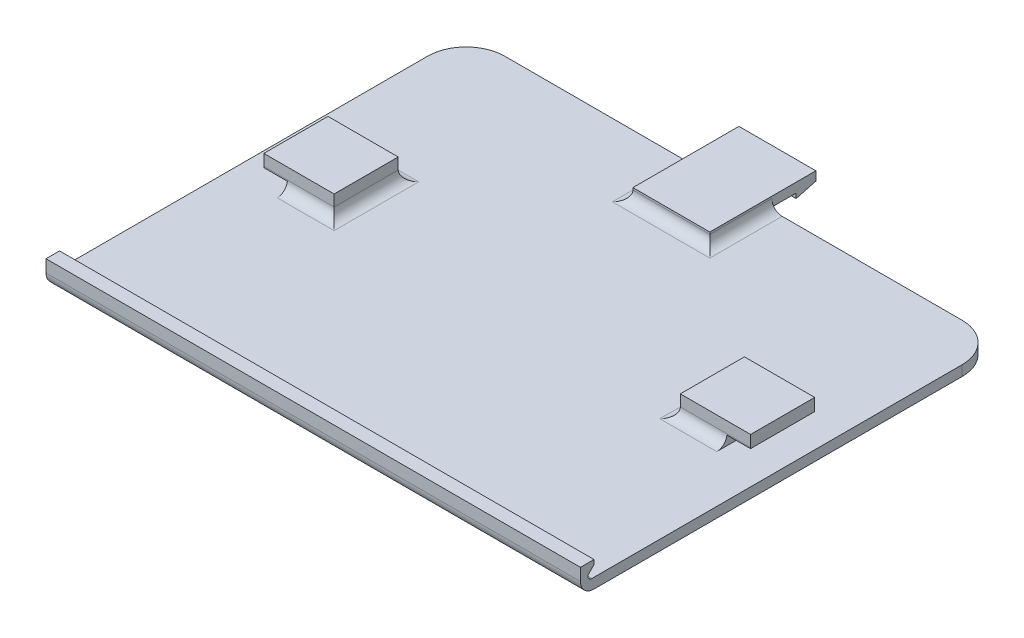
from build123d import *

# Parameters (mm, degrees)
SKETCH1_W            = 66.675
SKETCH1_H            = 52.2732
BOSS_EXTRUDE1_DEPTH  = 1.27
BOSS_EXTRUDE3_DEPTH  = 4.7625
BOSS_EXTRUDE4_DEPTH  = 7.9375
CUT_EXTRUDE2_DEPTH   = 2.921
FILLET1_R            = 1.27
FILLET2_R            = 1.27
MIRROR1_START        = 20.16125
MIRROR1_DEPTH        = 7.0485
MIRROR1_START_2      = 27.20975
MIRROR1_2_DEPTH      = 2.921
MIRROR1_START_3      = -8
MIRROR1_3_DEPTH      = 12
SKETCH7_W            = 1.016
SKETCH7_H            = 1.905
BOSS_EXTRUDE5_DEPTH  = 66.675
SKETCH8_W            = 66.675
SKETCH8_H            = 0.6604
BOSS_EXTRUDE6_DEPTH  = 0.762
FILLET5_R            = 1.651
SKETCH10_W           = 9.525
SKETCH10_H           = 2.7178
CUT_EXTRUDE3_DEPTH   = 0.1016
SKETCH11_W           = 66.675
SKETCH11_H           = 1.2446
CUT_EXTRUDE4_DEPTH   = 0.1016
SKETCH12_W           = 107.616027614
SKETCH12_H           = 63.046095141
SKETCH12_W_2         = 66.167
SKETCH12_H_2         = 53.768388695
CUT_EXTRUDE5_DEPTH   = 46.918560191
FILLET6_R            = 4.7625
SKETCH13_W           = 0.8636
SKETCH13_H           = 0.6604
CUT_EXTRUDE6_DEPTH   = 74.315736052
BOSS_EXTRUDE8_DEPTH  = 66.167
FILLET7_R            = 0.508
BOSS_EXTRUDE9_DEPTH  = 66.167
SKETCH17_W           = 9.525
SKETCH17_H           = 1.1684
BOSS_EXTRUDE10_DEPTH = 1.27
SKETCH18_W           = 12.7
SKETCH18_H           = 4.7625
BOSS_EXTRUDE13_DEPTH = 0.508
FILLET8_R            = 0.3048


with BuildPart() as part:
    # Sketch1 → Boss-Extrude1 (new body)
    with BuildSketch(Plane(origin=(0, 0, 0), x_dir=(1, 0, 0), z_dir=(0, 1, 0))):
        Rectangle(SKETCH1_W, SKETCH1_H)
    extrude(amount=BOSS_EXTRUDE1_DEPTH)

    # Sketch4 → Boss-Extrude3 (add, symmetric)
    with BuildSketch(Plane(origin=(0, 0, 0), x_dir=(0, 0, -1), z_dir=(1, 0, 0))):
        Polygon((28.987783874, 1.055971868), (31.3309, 1.683807942), (31.3309, 2.794), (18.1991, 2.794), (18.1991, 1.27), (26.1366, 1.27), (26.1366, 1.524), (28.8544, 1.524), (28.8544, 1.055971868), align=None)
    extrude(amount=BOSS_EXTRUDE3_DEPTH, both=True)

    # Sketch5 → Boss-Extrude4 (add)
    with BuildSketch(Plane(origin=(0, 0, -5.8166), x_dir=(-1, 0, 0), z_dir=(0, 0, -1))):
        Polygon((21.43125, 1.27), (27.20975, 1.27), (27.20975, 2.413), (30.13075, 2.413), (30.13075, 3.937), (21.43125, 3.937), align=None)
    extrude(amount=-BOSS_EXTRUDE4_DEPTH)

    # Sketch6 → Cut-Extrude2 (cut)
    with BuildSketch(Plane.ZY.offset(30.13075)):
        Polygon((-5.8166, 2.413), (-3.2766, 2.413), (-5.8166, 3.093590949), align=None)
    extrude(amount=-CUT_EXTRUDE2_DEPTH, mode=Mode.SUBTRACT)

    # Fillet1
    fillet1_edges = [part.edges().sort_by_distance(p)[0] for p in [
        (-24.3205, 1.27, 2.1209),
        (-21.43125, 1.27, -1.84785),
        (-24.3205, 1.27, -5.8166),
    ]]
    fillet(fillet1_edges, radius=FILLET1_R)

    # Fillet2
    # the kernel refuses this fillet: 1.27 mm, written as the material it adds along each edge
    with BuildSketch(Plane(origin=(-4.7625, 1.27, -18.1991), x_dir=(-1, 0, 0), z_dir=(0, 0, -1))) as fillet2_piece_1:
        with BuildLine():
            CenterArc((FILLET2_R, FILLET2_R), FILLET2_R, 180, 90)
            Line((0, FILLET2_R), (-FILLET2_R * 0.02, FILLET2_R))
            Line((-FILLET2_R * 0.02, FILLET2_R), (-FILLET2_R * 0.02, -FILLET2_R * 0.02))
            Line((-FILLET2_R * 0.02, -FILLET2_R * 0.02), (FILLET2_R, -FILLET2_R * 0.02))
            Line((FILLET2_R, -FILLET2_R * 0.02), (FILLET2_R, 0))
        make_face()
    extrude(amount=7.9375)
    with BuildSketch(Plane(origin=(-4.7625, 1.27, -18.1991), x_dir=(0, 0, 1), z_dir=(1, 0, 0))) as fillet2_piece_2:
        with BuildLine():
            CenterArc((FILLET2_R, -FILLET2_R), FILLET2_R, 90, 90)
            Line((0, -FILLET2_R), (-FILLET2_R * 0.02, -FILLET2_R))
            Line((-FILLET2_R * 0.02, -FILLET2_R), (-FILLET2_R * 0.02, FILLET2_R * 0.02))
            Line((-FILLET2_R * 0.02, FILLET2_R * 0.02), (FILLET2_R, FILLET2_R * 0.02))
            Line((FILLET2_R, FILLET2_R * 0.02), (FILLET2_R, 0))
        make_face()
    extrude(amount=9.525)
    with BuildSketch(Plane(origin=(4.7625, 1.27, -18.1991), x_dir=(1, 0, 0), z_dir=(0, 0, -1))) as fillet2_piece_3:
        with BuildLine():
            CenterArc((FILLET2_R, -FILLET2_R), FILLET2_R, 90, 90)
            Line((0, -FILLET2_R), (-FILLET2_R * 0.02, -FILLET2_R))
            Line((-FILLET2_R * 0.02, -FILLET2_R), (-FILLET2_R * 0.02, FILLET2_R * 0.02))
            Line((-FILLET2_R * 0.02, FILLET2_R * 0.02), (FILLET2_R, FILLET2_R * 0.02))
            Line((FILLET2_R, FILLET2_R * 0.02), (FILLET2_R, 0))
        make_face()
    extrude(amount=7.9375)
    with BuildSketch(Plane(origin=(-4.7625, 1.27, -15.0241), x_dir=(-1, 0, 0), z_dir=(0, 0, -1))) as fillet2_piece_4a_section:
        with BuildLine():
            CenterArc((FILLET2_R, FILLET2_R), FILLET2_R, 180, 90)
            Line((0, FILLET2_R), (-FILLET2_R * 0.02, FILLET2_R))
            Line((-FILLET2_R * 0.02, FILLET2_R), (-FILLET2_R * 0.02, -FILLET2_R * 0.02))
            Line((-FILLET2_R * 0.02, -FILLET2_R * 0.02), (FILLET2_R, -FILLET2_R * 0.02))
            Line((FILLET2_R, -FILLET2_R * 0.02), (FILLET2_R, 0))
        make_face()
    fillet2_piece_4a = extrude(amount=11.1125, mode=Mode.PRIVATE)
    fillet2_piece_4a = split(fillet2_piece_4a, bisect_by=Plane(origin=(-4.7625, 1.27, -18.1991), z_dir=(0, 0, 1)), keep=Keep.TOP, mode=Mode.PRIVATE)
    with BuildSketch(Plane(origin=(-7.9375, 1.27, -18.1991), x_dir=(0, 0, 1), z_dir=(1, 0, 0))) as fillet2_piece_4b_section:
        with BuildLine():
            CenterArc((FILLET2_R, -FILLET2_R), FILLET2_R, 90, 90)
            Line((0, -FILLET2_R), (-FILLET2_R * 0.02, -FILLET2_R))
            Line((-FILLET2_R * 0.02, -FILLET2_R), (-FILLET2_R * 0.02, FILLET2_R * 0.02))
            Line((-FILLET2_R * 0.02, FILLET2_R * 0.02), (FILLET2_R, FILLET2_R * 0.02))
            Line((FILLET2_R, FILLET2_R * 0.02), (FILLET2_R, 0))
        make_face()
    fillet2_piece_4b = extrude(amount=12.7, mode=Mode.PRIVATE)
    fillet2_piece_4b = split(fillet2_piece_4b, bisect_by=Plane(origin=(-4.7625, 1.27, -18.1991), z_dir=(-1, 0, 0)), keep=Keep.TOP, mode=Mode.PRIVATE)
    fillet2_piece_4 = fillet2_piece_4a & fillet2_piece_4b
    add(fillet2_piece_4)
    with BuildSketch(Plane(origin=(-4.7625, 1.27, -18.1991), x_dir=(0, 0, 1), z_dir=(1, 0, 0))) as fillet2_piece_5a_section:
        with BuildLine():
            CenterArc((FILLET2_R, -FILLET2_R), FILLET2_R, 90, 90)
            Line((0, -FILLET2_R), (-FILLET2_R * 0.02, -FILLET2_R))
            Line((-FILLET2_R * 0.02, -FILLET2_R), (-FILLET2_R * 0.02, FILLET2_R * 0.02))
            Line((-FILLET2_R * 0.02, FILLET2_R * 0.02), (FILLET2_R, FILLET2_R * 0.02))
            Line((FILLET2_R, FILLET2_R * 0.02), (FILLET2_R, 0))
        make_face()
    fillet2_piece_5a = extrude(amount=12.7, mode=Mode.PRIVATE)
    fillet2_piece_5a = split(fillet2_piece_5a, bisect_by=Plane(origin=(4.7625, 1.27, -18.1991), z_dir=(1, 0, 0)), keep=Keep.TOP, mode=Mode.PRIVATE)
    with BuildSketch(Plane(origin=(4.7625, 1.27, -15.0241), x_dir=(1, 0, 0), z_dir=(0, 0, -1))) as fillet2_piece_5b_section:
        with BuildLine():
            CenterArc((FILLET2_R, -FILLET2_R), FILLET2_R, 90, 90)
            Line((0, -FILLET2_R), (-FILLET2_R * 0.02, -FILLET2_R))
            Line((-FILLET2_R * 0.02, -FILLET2_R), (-FILLET2_R * 0.02, FILLET2_R * 0.02))
            Line((-FILLET2_R * 0.02, FILLET2_R * 0.02), (FILLET2_R, FILLET2_R * 0.02))
            Line((FILLET2_R, FILLET2_R * 0.02), (FILLET2_R, 0))
        make_face()
    fillet2_piece_5b = extrude(amount=11.1125, mode=Mode.PRIVATE)
    fillet2_piece_5b = split(fillet2_piece_5b, bisect_by=Plane(origin=(4.7625, 1.27, -18.1991), z_dir=(0, 0, 1)), keep=Keep.TOP, mode=Mode.PRIVATE)
    fillet2_piece_5 = fillet2_piece_5a & fillet2_piece_5b
    add(fillet2_piece_5)

    # Mirror1: read off the stored shape, not the designer's step
    # Mirror1 outline → Mirror1 (add)
    with BuildSketch(Plane.YZ.offset(MIRROR1_START)):
        with BuildLine():
            Line((3.937, -5.8166), (3.937, 2.1209))
            Line((3.937, 2.1209), (2.54, 2.1209))
            ThreePointArc((2.54, 2.1209), (1.641974388, 2.492874388), (1.27, 3.3909))
            Line((1.27, 3.3909), (1.27, -7.0866))
            ThreePointArc((1.27, -7.0866), (1.641974388, -6.188574388), (2.54, -5.8166))
            Line((2.54, -5.8166), (3.937, -5.8166))
        make_face()
    extrude(amount=MIRROR1_DEPTH)

    # Mirror1 2 outline → Mirror1 2 (add)
    with BuildSketch(Plane.YZ.offset(MIRROR1_START_2)):
        with BuildLine():
            Line((3.937, -5.8166), (3.937, 2.1209))
            Line((3.937, 2.1209), (2.54, 2.1209))
            ThreePointArc((2.54, 2.1209), (2.476420276, 2.122492487), (2.413, 2.127265955))
            Line((2.413, 2.127265955), (2.413, -5.822965955))
            ThreePointArc((2.413, -5.822965955), (2.476420276, -5.818192487), (2.54, -5.8166))
            Line((2.54, -5.8166), (3.937, -5.8166))
        make_face()
    extrude(amount=MIRROR1_2_DEPTH)

    # Mirror1 3 outline → Mirror1 3 (cut)
    with BuildSketch(Plane.XY.offset(MIRROR1_START_3)):
        with BuildLine():
            ThreePointArc((20.16125, 1.27), (21.059275612, 1.641974388), (21.43125, 2.54))
            Line((21.43125, 2.54), (21.43125, 3.937))
            Line((21.43125, 3.937), (20.16125, 3.937))
            Line((20.16125, 3.937), (20.16125, 1.27))
        make_face()
    extrude(amount=MIRROR1_3_DEPTH, mode=Mode.SUBTRACT)

    # Sketch7 → Boss-Extrude5 (add)
    with BuildSketch(Plane.ZY.offset(33.3375)):
        with Locations((25.6286, 2.2225)):
            Rectangle(SKETCH7_W, SKETCH7_H)
    extrude(amount=-BOSS_EXTRUDE5_DEPTH)

    # Sketch8 → Boss-Extrude6 (add)
    with BuildSketch(Plane(origin=(0, 0, 25.1206), x_dir=(-1, 0, 0), z_dir=(0, 0, -1))):
        with Locations((0, 2.8448)):
            Rectangle(SKETCH8_W, SKETCH8_H)
    extrude(amount=BOSS_EXTRUDE6_DEPTH)

    # Fillet5
    fillet5_edges = [part.edges().sort_by_distance(p)[0] for p in [
        (0, 0, 26.1366),
    ]]
    fillet(fillet5_edges, radius=FILLET5_R)

    # Sketch10 → Cut-Extrude3 (cut)
    with BuildSketch(Plane.XZ.offset(-1.524)):
        with Locations((0, -27.4955)):
            Rectangle(SKETCH10_W, SKETCH10_H)
    extrude(amount=-CUT_EXTRUDE3_DEPTH, mode=Mode.SUBTRACT)

    # Sketch11 → Cut-Extrude4 (cut)
    with BuildSketch(Plane(origin=(0, 0, 25.1206), x_dir=(-1, 0, 0), z_dir=(0, 0, -1))):
        with Locations((0, 1.8923)):
            Rectangle(SKETCH11_W, SKETCH11_H)
    extrude(amount=-CUT_EXTRUDE4_DEPTH, mode=Mode.SUBTRACT)

    # Sketch12 → Cut-Extrude5 (cut, through all)
    with BuildSketch(Plane.XZ):
        with Locations((0, 4.37044757)):
            Rectangle(SKETCH12_W, SKETCH12_H)
        with Locations((0, 1.001594348)):
            Rectangle(SKETCH12_W_2, SKETCH12_H_2, mode=Mode.SUBTRACT)
    extrude(amount=-CUT_EXTRUDE5_DEPTH, mode=Mode.SUBTRACT)


with BuildPart() as cut_extrude5_piece_1:
    # of the separate pieces the step leaves, piece 1, a body of its own (cut_extrude5_pieces)
    add(part.part.solids().sort_by_distance((33.0835, 1.651, 26.1366))[0])

    # Fillet6
    fillet6_edges = [cut_extrude5_piece_1.edges().sort_by_distance(p)[0] for p in [
        (-33.0835, 0.635, -25.8826),
        (33.0835, 0.635, -25.8826),
    ]]
    fillet(fillet6_edges, radius=FILLET6_R)

    # Sketch13 → Cut-Extrude6 (cut, through all)
    with BuildSketch(Plane.ZY.offset(33.0835)):
        with Locations((24.7904, 2.8448)):
            Rectangle(SKETCH13_W, SKETCH13_H)
    extrude(amount=-CUT_EXTRUDE6_DEPTH, mode=Mode.SUBTRACT)

    # Sketch14 → Boss-Extrude8 (add)
    with BuildSketch(Plane.ZY.offset(33.0835)):
        Polygon((25.2222, 3.175), (24.5872, 3.175), (24.5872, 2.54), (25.2222, 1.905), align=None)
    extrude(amount=-BOSS_EXTRUDE8_DEPTH)

    # Fillet7
    fillet7_edges = [cut_extrude5_piece_1.edges().sort_by_distance(p)[0] for p in [
        (0, 1.27, 25.2222),
    ]]
    fillet(fillet7_edges, radius=FILLET7_R)

    # Sketch16 → Boss-Extrude9 (add)
    with BuildSketch(Plane.ZY.offset(33.0835)):
        Polygon((25.2222, 3.175), (24.4602, 3.175), (24.4602, 2.6162), (25.2222, 1.8542), align=None)
    extrude(amount=-BOSS_EXTRUDE9_DEPTH)



with BuildPart() as cut_extrude5_piece_2:
    # of the separate pieces the step leaves, piece 2, a body of its own (cut_extrude5_pieces)
    add(part.part.solids().sort_by_distance((4.7625, 1.6256, -27.1526))[0])


with BuildPart() as cut_extrude5_piece_1_1:
    add(cut_extrude5_piece_1.part)

    add(cut_extrude5_piece_2.part)  # Boss-Extrude10 merges Cut-Extrude5 piece 2
    # Sketch17 → Boss-Extrude10 (add)
    with BuildSketch(Plane.XY.offset(-27.1526)):
        with Locations((0, 2.2098)):
            Rectangle(SKETCH17_W, SKETCH17_H)
    extrude(amount=BOSS_EXTRUDE10_DEPTH)

    # Sketch18 → Boss-Extrude13 (add)
    with BuildSketch(Plane.XZ):
        with Locations((0, -20.32635)):
            Rectangle(SKETCH18_W, SKETCH18_H)
    extrude(amount=BOSS_EXTRUDE13_DEPTH)

    # Fillet8
    fillet8_edges = [cut_extrude5_piece_1_1.edges().sort_by_distance(p)[0] for p in [
        (6.35, -0.254, -22.7076),
        (6.35, -0.254, -17.9451),
        (-6.35, -0.254, -17.9451),
        (-6.35, -0.254, -22.7076),
        (6.35, -0.508, -20.32635),
        (0, -0.508, -17.9451),
        (-6.35, -0.508, -20.32635),
        (0, -0.508, -22.7076),
    ]]
    fillet(fillet8_edges, radius=FILLET8_R)


solid = cut_extrude5_piece_1_1.part
